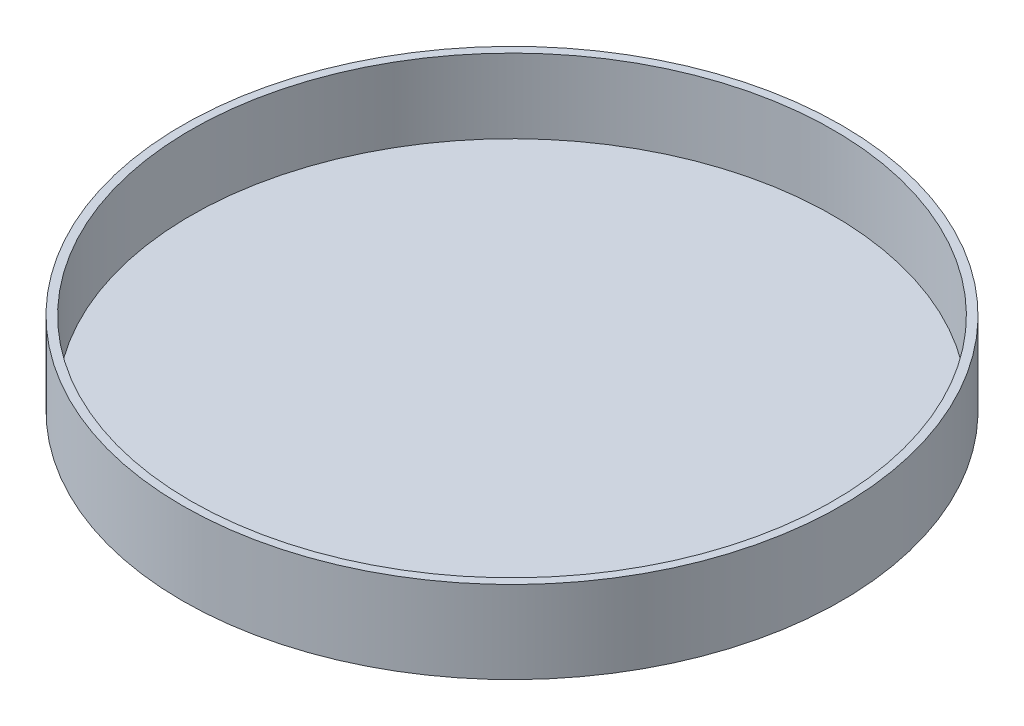
from build123d import *

# Parameters (mm, degrees)
ESQUISSE1_R             = 160
BOSS_EXTRU_1_DEPTH      = 40
ESQUISSE2_R             = 156
ENL_V_MAT_EXTRU_1_DEPTH = 4
COQUE2_START            = 4
COQUE2_OUTLINE_R        = 156
COQUE2_DEPTH            = 32


# Read off the part's stored shape, not the designer's step: Coque2
with BuildPart() as part:
    # Esquisse1 → Boss.-Extru.1 (new body)
    with BuildSketch(Plane(origin=(0, 0, 0), x_dir=(1, 0, 0), z_dir=(0, 1, 0))):
        with Locations(Location((0, 0, 0), (0, 0, 270))):
            Circle(ESQUISSE1_R)
    extrude(amount=BOSS_EXTRU_1_DEPTH)

    # Esquisse2 → Enlèv. mat.-Extru.1 (cut)
    with BuildSketch(Plane(origin=(0, 40, 0), x_dir=(1, 0, 0), z_dir=(0, 1, 0))):
        with Locations(Location((0, 0, 0), (0, 0, 270))):
            Circle(ESQUISSE2_R)
    extrude(amount=-ENL_V_MAT_EXTRU_1_DEPTH, mode=Mode.SUBTRACT)

    # Coque2 outline → Coque2 (cut)
    with BuildSketch(Plane(origin=(0, 0, 0), x_dir=(1, 0, 0), z_dir=(0, 1, 0)).offset(COQUE2_START)):
        Circle(COQUE2_OUTLINE_R)
    extrude(amount=COQUE2_DEPTH, mode=Mode.SUBTRACT)


solid = part.part
